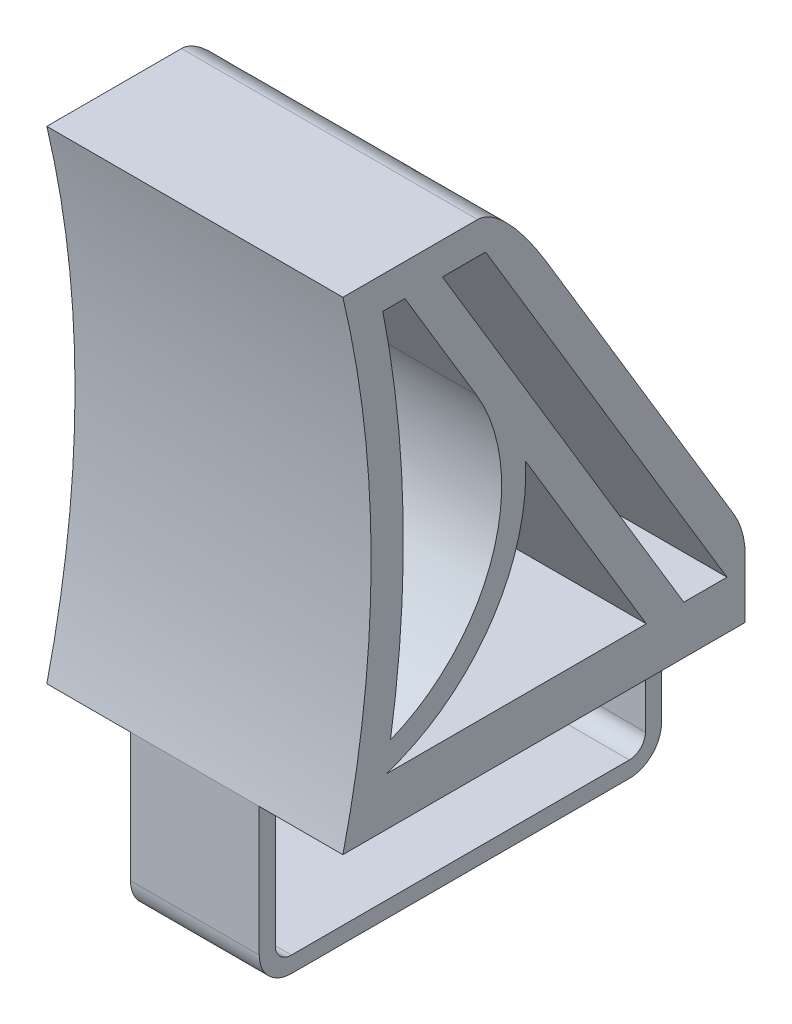
from build123d import *

# Parameters (mm, degrees)
BOSS_EXTRUDE1_DEPTH = 18.4
FILLET2_R           = 5
SKETCH2_W           = 12
SKETCH2_H           = 25
BOSS_EXTRUDE2_DEPTH = 10
SKETCH3_R           = 2.2
CUT_EXTRUDE1_DEPTH  = 42.905131118
FILLET3_R           = 2
SKETCH4_R           = 2.2
CUT_EXTRUDE2_DEPTH  = 2
CUT_EXTRUDE3_START  = -6
CUT_EXTRUDE3_DEPTH  = 4


with BuildPart() as part:
    # Sketch1 → Boss-Extrude1 (new body)
    # profile 1 of 2: a face of its own
    with BuildSketch(Plane(origin=(0, 0, 0), x_dir=(0, 0, -1), z_dir=(1, 0, 0))):
        with BuildLine():
            Line((10, 30), (0, 30))
            ThreePointArc((0, 30), (1.754446797, 15), (0, 0))
            Line((0, 0), (25, 0))
            Line((25, 0), (25, 5))
            Line((25, 5), (10, 30))
        make_face()
        with BuildLine():
            ThreePointArc((2.481153697, 28), (3.752513812, 15.508936318), (2.671060787, 3))
            Line((2.671060787, 3), (18.853000612, 3))
            Line((18.853000612, 3), (3.853000612, 28))
            Line((3.853000612, 28), (2.481153697, 28))
        make_face(mode=Mode.SUBTRACT)
        Polygon((21.18538137, 3), (23.867619242, 3), (8.867619242, 28), (6.18538137, 28), align=None, mode=Mode.SUBTRACT)
    # profile 2 of 2: a face of its own
    with BuildSketch(Plane(origin=(0, 0, 0), x_dir=(0, 0, -1), z_dir=(1, 0, 0))):
        with BuildLine():
            Line((11.353000612, 15.5), (8.295219913, 20.596301166))
            ThreePointArc((8.295219913, 20.596301166), (9.29299781, 11.415857711), (2.957581264, 4.69733109))
            ThreePointArc((2.957581264, 4.69733109), (2.819772168, 3.847745357), (2.671060787, 3))
            ThreePointArc((2.671060787, 3), (9.128517918, 7.779982826), (11.353000612, 15.5))
        make_face()
    extrude(amount=BOSS_EXTRUDE1_DEPTH)

    # Fillet1
    # an asymmetric fillet: 7, 5 mm, written as the material it takes off along each edge
    with BuildSketch(Plane(origin=(-12.908331632, 30, -10), x_dir=(0, 0, 1), z_dir=(1, 0, 0))) as fillet1_piece_1:
        with BuildLine():
            Bezier((1.630951895, 0), (0, 0), (-2.656512734, 4.427521223), weights=[1, 0.870199907, 1])
            Line((-2.656512734, 4.427521223), (0, 0))
            Line((0, 0), (1.630951895, 0))
        make_face()
    extrude(amount=44.216663264, mode=Mode.SUBTRACT)

    # Fillet2
    fillet2_edges = [part.edges().sort_by_distance(p)[0] for p in [
        (9.2, 5, -25),
    ]]
    fillet(fillet2_edges, radius=FILLET2_R)

    # Sketch2 → Boss-Extrude2 (add)
    with BuildSketch(Plane(origin=(0, 0, 0), x_dir=(-1, 0, 0), z_dir=(0, -1, 0))):
        with Locations((-9.2, 12.5)):
            Rectangle(SKETCH2_W, SKETCH2_H)
    extrude(amount=BOSS_EXTRUDE2_DEPTH)

    # Sketch3 → Cut-Extrude1 (cut, through all)
    with BuildSketch(Plane(origin=(15.2, 0, 0), x_dir=(0, 0, -1), z_dir=(1, 0, 0))):
        with Locations((5, -6)):
            Circle(SKETCH3_R)
        with Locations((20, -6)):
            Circle(SKETCH3_R)
    extrude(amount=-CUT_EXTRUDE1_DEPTH, mode=Mode.SUBTRACT)

    # Fillet3
    fillet3_edges = [part.edges().sort_by_distance(p)[0] for p in [
        (9.2, -10, -25),
        (9.2, -10, 0),
    ]]
    fillet(fillet3_edges, radius=FILLET3_R)

    # Sketch4 → Cut-Extrude2 (cut)
    # profile 1 of 2: a face of its own
    with BuildSketch(Plane(origin=(15.2, 0, 0), x_dir=(0, 0, -1), z_dir=(1, 0, 0))):
        with BuildLine():
            Line((25, 0), (0, 0))
            Line((0, 0), (0, -8))
            ThreePointArc((0, -8), (0.585786438, -9.414213562), (2, -10))
            Line((2, -10), (23, -10))
            ThreePointArc((23, -10), (24.414213562, -9.414213562), (25, -8))
            Line((25, -8), (25, 0))
        make_face()
        with BuildLine():
            ThreePointArc((23, -9), (23.707106781, -8.707106781), (24, -8))
            Line((24, -8), (24, -1))
            Line((24, -1), (1, -1))
            Line((1, -1), (1, -8))
            ThreePointArc((1, -8), (1.292893219, -8.707106781), (2, -9))
            Line((2, -9), (23, -9))
        make_face(mode=Mode.SUBTRACT)
    # profile 2 of 2: a face of its own
    with BuildSketch(Plane(origin=(15.2, 0, 0), x_dir=(0, 0, -1), z_dir=(1, 0, 0))):
        with BuildLine():
            Line((2, -9), (23, -9))
            ThreePointArc((23, -9), (23.707106781, -8.707106781), (24, -8))
            Line((24, -8), (24, -1))
            Line((24, -1), (1, -1))
            Line((1, -1), (1, -8))
            ThreePointArc((1, -8), (1.292893219, -8.707106781), (2, -9))
        make_face()
        with Locations((5, -6)):
            Circle(SKETCH4_R, mode=Mode.SUBTRACT)
        with Locations((20, -6)):
            Circle(SKETCH4_R, mode=Mode.SUBTRACT)
    cut_extrude2 = extrude(amount=-CUT_EXTRUDE2_DEPTH, mode=Mode.SUBTRACT)

    # Sketch4<3> → Cut-Extrude3 (cut)
    with BuildSketch(Plane(origin=(15.2, 0, 0), x_dir=(0, 0, -1), z_dir=(1, 0, 0)).offset(CUT_EXTRUDE3_START)):
        with BuildLine():
            Line((1, -1), (1, -8))
            ThreePointArc((1, -8), (1.292893219, -8.707106781), (2, -9))
            Line((2, -9), (23, -9))
            ThreePointArc((23, -9), (23.707106781, -8.707106781), (24, -8))
            Line((24, -8), (24, -1))
            Line((24, -1), (1, -1))
        make_face()
    cut_extrude3 = extrude(amount=CUT_EXTRUDE3_DEPTH, mode=Mode.SUBTRACT)

    # Mirror1: Cut-Extrude2, Cut-Extrude3 across plane
    add(cut_extrude2.mirror(Plane(origin=(9.2, 0, 0), x_dir=(0, 0, 1), z_dir=(1, 0, 0))), mode=Mode.SUBTRACT)
    add(cut_extrude3.mirror(Plane(origin=(9.2, 0, 0), x_dir=(0, 0, 1), z_dir=(1, 0, 0))), mode=Mode.SUBTRACT)


solid = part.part
